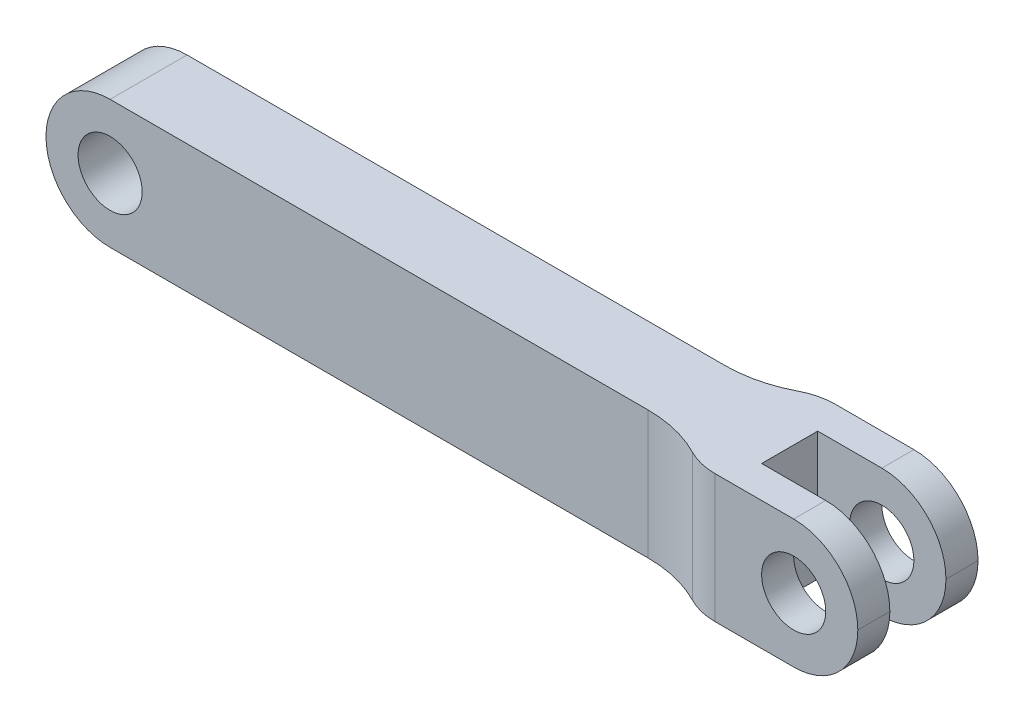
from build123d import *

# Parameters (mm, degrees)
SCHIZZO1_R                        = 5
ESTRUSIONE_ESTRUSIONE1_DEPTH      = 12
ESTRUSIONE_ESTRUSIONE2_DEPTH      = 20
ESTRUSIONE_ESTRUSIONE2_DEPTH_BACK = 5
SCHIZZO3_W                        = 5
SCHIZZO3_H                        = 20
RACCORDO1_R                       = 20
RACCORDO2_R                       = 10
RACCORDO3_R                       = 10
TAGLIO_ESTRUSIONE1_DEPTH          = 122.866986916
TAGLIO_ESTRUSIONE1_DEPTH_BACK     = 122.866986916
SCHIZZO4_R                        = 5


# Some blends are built 0.0001 mm under size
with BuildPart() as part:
    # Schizzo1 → Estrusione-Estrusione1 (new body)
    with BuildSketch(Plane.XY):
        with BuildLine():
            Line((0, 10), (100, 10))
            Line((100, 10), (100, -10))
            Line((100, -10), (0, -10))
            ThreePointArc((0, -10), (-10, 0), (0, 10))
        make_face()
        Circle(SCHIZZO1_R, mode=Mode.SUBTRACT)
    extrude(amount=ESTRUSIONE_ESTRUSIONE1_DEPTH)

    # Schizzo3 → Estrusione-Estrusione2 (add, two sides: drawn at the far end of the back side and taken through both)
    with BuildSketch(Plane(origin=(100, 0, 0), x_dir=(0, 0, -1), z_dir=(1, 0, 0)).offset(-ESTRUSIONE_ESTRUSIONE2_DEPTH_BACK)):
        with Locations((-12.875, 0)):
            Rectangle(SCHIZZO3_W, SCHIZZO3_H)
        with Locations((0.875, 0)):
            Rectangle(SCHIZZO3_W, SCHIZZO3_H)
    extrude(amount=ESTRUSIONE_ESTRUSIONE2_DEPTH + ESTRUSIONE_ESTRUSIONE2_DEPTH_BACK)

    # Raccordo1
    # the kernel refuses this fillet: 20 mm, written as the material it adds along each edge
    with BuildSketch(Plane(origin=(95, 10, 12), x_dir=(-1, 0, 0), z_dir=(0, -1, 0)), Plane(origin=(95, -10, 0), x_dir=(-1, 0, 0), z_dir=(0, 1, 0))) as raccordo1_piece_1:
        with BuildLine():
            CenterArc((11.11797531, -20), RACCORDO1_R, 90, 33.772641851)
            Line((0, -3.375), (-0.222359506, -3.0425))
            ThreePointArc((-0.222359506, -3.0425), (-0.4, -1.6875), (-0.4, 0))
            Line((-0.4, 0), (0, 0.4))
            Line((0, 0.4), (11.11797531, 0.4))
            Line((11.11797531, 0.4), (11.11797531, 0))
        make_face()
    extrude(amount=20)

    # Raccordo2
    raccordo2_edges = [part.edges().sort_by_distance(p)[0] for p in [
        (95, 0, -3.375),
        (95, 0, 15.375),
    ]]
    fillet(raccordo2_edges, radius=RACCORDO2_R)

    # Raccordo3
    raccordo3_edges = [part.edges().sort_by_distance(p)[0] for p in [
        (120, -10, 12.875),
        (120, 10, 12.875),
        (120, -10, -0.875),
        (120, 10, -0.875),
    ]]
    fillet(raccordo3_edges, radius=RACCORDO3_R - 0.0001)  # a hair under: the kernel refuses the full size

    # Schizzo4 → Taglio-Estrusione1 (cut, two sides: drawn at the far end of the back side and taken through both)
    with BuildSketch(Plane(origin=(0, 0, -3.375), x_dir=(-1, 0, 0), z_dir=(0, 0, -1)).offset(-TAGLIO_ESTRUSIONE1_DEPTH_BACK)):
        with Locations(Location((-110, 0, 0), (0, 0, 90))):
            Circle(SCHIZZO4_R)
    extrude(amount=TAGLIO_ESTRUSIONE1_DEPTH + TAGLIO_ESTRUSIONE1_DEPTH_BACK, mode=Mode.SUBTRACT)


solid = part.part
